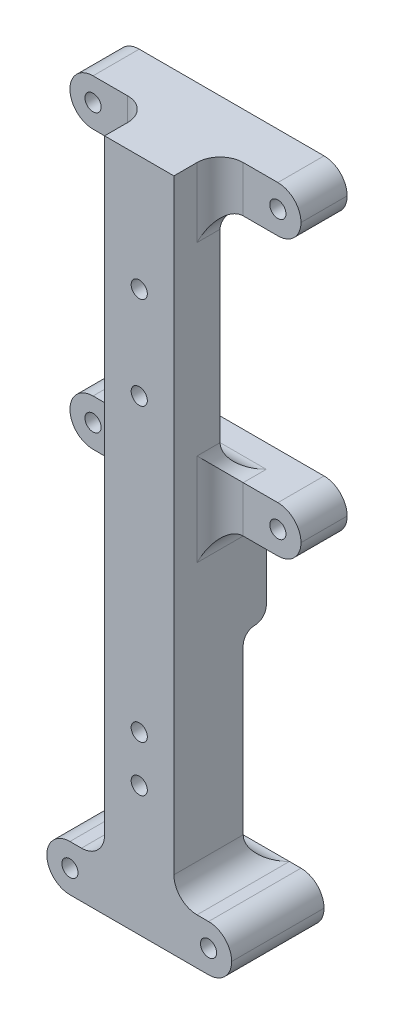
from build123d import *

# Parameters (mm, degrees)
SKETCH1_W                = 50
SKETCH1_H                = 10
BOSS_EXTRUDE1_DEPTH      = 10
BOSS_EXTRUDE1_2_DEPTH    = 10
SKETCH2_W                = 15
SKETCH2_H                = 70
BOSS_EXTRUDE2_DEPTH      = 10
CUT_EXTRUDE1_REACH       = 49.434
SKETCH3_R                = 1.75
CUT_EXTRUDE2_REACH       = 46.159
SKETCH4_R                = 1.75
FILLET2_R                = 5
FILLET4_R                = 5
FILLET5_R                = 5
FILLET6_R                = 5
SKETCH5_W                = 15
SKETCH5_H                = 20
BOSS_EXTRUDE3_DEPTH      = 66
BOSS_EXTRUDE4_DEPTH      = 20
BOSS_EXTRUDE4_DEPTH_BACK = 20
SKETCH6_W                = 20
SKETCH6_H                = 10
CUT_EXTRUDE3_REACH       = 117.525
SKETCH7_R                = 1.75
FILLET7_R                = 5
FILLET9_R                = 5
FILLET10_R               = 5
SKETCH8_R                = 1.75
CUT_EXTRUDE4_DEPTH       = 116.524889093
SKETCH11_W               = 15
SKETCH11_H               = 43
CUT_EXTRUDE5_DEPTH       = 5
FILLET11_R               = 5
FILLET13_R               = 2.5


# Some blends are built 0.0001 mm under size
with BuildPart() as part:
    # Sketch1 → Boss-Extrude1 (new body)
    with BuildSketch(Plane.XY):
        with Locations((0, 30)):
            Rectangle(SKETCH1_W, SKETCH1_H)
    extrude(amount=BOSS_EXTRUDE1_DEPTH)



with BuildPart() as body_2:
    # Sketch1 → Boss-Extrude1 2 (new body)
    with BuildSketch(Plane.XY):
        with Locations((0, -30)):
            Rectangle(SKETCH1_W, SKETCH1_H)
    extrude(amount=BOSS_EXTRUDE1_2_DEPTH)


with BuildPart() as part_1:
    add(part.part)

    add(body_2.part)  # Boss-Extrude2 merges body 2
    # Sketch2 → Boss-Extrude2 (add)
    with BuildSketch(Plane.XY.offset(10)):
        Rectangle(SKETCH2_W, SKETCH2_H)
    extrude(amount=BOSS_EXTRUDE2_DEPTH)

    # Sketch3 → Cut-Extrude1 (cut, up to next)
    with BuildSketch(Plane.XY.offset(20), mode=Mode.PRIVATE) as cut_extrude1_sk1:
        with Locations((0, 10)):
            Circle(SKETCH3_R)
    cut_extrude1_tool1 = extrude(cut_extrude1_sk1.sketch, amount=-CUT_EXTRUDE1_REACH, mode=Mode.PRIVATE) & part_1.part
    # Sketch3 → Cut-Extrude1 (cut, up to next)
    with BuildSketch(Plane.XY.offset(20), mode=Mode.PRIVATE) as cut_extrude1_sk2:
        with Locations((0, -10)):
            Circle(SKETCH3_R)
    cut_extrude1_tool2 = extrude(cut_extrude1_sk2.sketch, amount=-CUT_EXTRUDE1_REACH, mode=Mode.PRIVATE) & part_1.part
    add(cut_extrude1_tool1.solids().sort_by_distance((0, 10, 20))[0], mode=Mode.SUBTRACT)
    add(cut_extrude1_tool2.solids().sort_by_distance((0, -10, 20))[0], mode=Mode.SUBTRACT)

    # Sketch4 → Cut-Extrude2 (cut, up to next)
    with BuildSketch(Plane.XY.offset(10), mode=Mode.PRIVATE) as cut_extrude2_sk1:
        with Locations((-20, 30)):
            Circle(SKETCH4_R)
    cut_extrude2_tool1 = extrude(cut_extrude2_sk1.sketch, amount=-CUT_EXTRUDE2_REACH, mode=Mode.PRIVATE) & part_1.part
    # Sketch4 → Cut-Extrude2 (cut, up to next)
    with BuildSketch(Plane.XY.offset(10), mode=Mode.PRIVATE) as cut_extrude2_sk2:
        with Locations((-20, -30)):
            Circle(SKETCH4_R)
    cut_extrude2_tool2 = extrude(cut_extrude2_sk2.sketch, amount=-CUT_EXTRUDE2_REACH, mode=Mode.PRIVATE) & part_1.part
    # Sketch4 → Cut-Extrude2 (cut, up to next)
    with BuildSketch(Plane.XY.offset(10), mode=Mode.PRIVATE) as cut_extrude2_sk3:
        with Locations((20, 30)):
            Circle(SKETCH4_R)
    cut_extrude2_tool3 = extrude(cut_extrude2_sk3.sketch, amount=-CUT_EXTRUDE2_REACH, mode=Mode.PRIVATE) & part_1.part
    # Sketch4 → Cut-Extrude2 (cut, up to next)
    with BuildSketch(Plane.XY.offset(10), mode=Mode.PRIVATE) as cut_extrude2_sk4:
        with Locations((20, -30)):
            Circle(SKETCH4_R)
    cut_extrude2_tool4 = extrude(cut_extrude2_sk4.sketch, amount=-CUT_EXTRUDE2_REACH, mode=Mode.PRIVATE) & part_1.part
    add(cut_extrude2_tool1.solids().sort_by_distance((-20, 30, 10))[0], mode=Mode.SUBTRACT)
    add(cut_extrude2_tool2.solids().sort_by_distance((-20, -30, 10))[0], mode=Mode.SUBTRACT)
    add(cut_extrude2_tool3.solids().sort_by_distance((20, 30, 10))[0], mode=Mode.SUBTRACT)
    add(cut_extrude2_tool4.solids().sort_by_distance((20, -30, 10))[0], mode=Mode.SUBTRACT)

    # Fillet2
    fillet2_edges = [part_1.edges().sort_by_distance(p)[0] for p in [
        (25, -35, 5),
        (25, -25, 5),
        (25, 35, 5),
        (25, 25, 5),
        (-25, 35, 5),
        (-25, 25, 5),
        (-25, -25, 5),
        (-25, -35, 5),
    ]]
    fillet(fillet2_edges, radius=FILLET2_R - 0.0001)  # a hair under: the kernel refuses the full size

    # Fillet4
    # the kernel refuses this fillet: 5 mm, written as the material it adds along each edge
    with BuildSketch(Plane(origin=(7.5, 25, 10), x_dir=(0, 0, -1), z_dir=(-1, 0, 0))) as fillet4_piece_1:
        with BuildLine():
            CenterArc((FILLET4_R, FILLET4_R), FILLET4_R, 180, 90)
            Line((0, FILLET4_R), (0, 0))
            Line((0, 0), (FILLET4_R, 0))
        make_face()
    extrude(amount=15)
    with BuildSketch(Plane(origin=(-7.5, -25, 10), x_dir=(0, 1, 0), z_dir=(1, 0, 0))) as fillet4_piece_2:
        with BuildLine():
            CenterArc((FILLET4_R, -FILLET4_R), FILLET4_R, 90, 90)
            Line((0, -FILLET4_R), (0, 0))
            Line((0, 0), (FILLET4_R, 0))
        make_face()
    extrude(amount=15)

    # Fillet5
    fillet5_edges = [part_1.edges().sort_by_distance(p)[0] for p in [
        (7.5, -25, 7.5),
        (7.5, 25, 7.5),
    ]]
    fillet(fillet5_edges, radius=FILLET5_R - 0.0001)  # a hair under: the kernel refuses the full size

    # Fillet6
    fillet6_edges = [part_1.edges().sort_by_distance(p)[0] for p in [
        (-7.5, -25, 7.5),
        (-7.5, 25, 7.5),
    ]]
    fillet(fillet6_edges, radius=FILLET6_R - 0.0001)  # a hair under: the kernel refuses the full size

    # Sketch5 → Boss-Extrude3 (add)
    with BuildSketch(Plane.XZ.offset(35)):
        with Locations((0, 10)):
            Rectangle(SKETCH5_W, SKETCH5_H)
    extrude(amount=BOSS_EXTRUDE3_DEPTH)

    # Sketch6 → Boss-Extrude4 (add, two sides: drawn at the far end of the back side and taken through both)
    with BuildSketch(Plane(origin=(0, 0, 0), x_dir=(0, 0, -1), z_dir=(1, 0, 0)).offset(-BOSS_EXTRUDE4_DEPTH_BACK)):
        with Locations((-10, -106)):
            Rectangle(SKETCH6_W, SKETCH6_H)
    extrude(amount=BOSS_EXTRUDE4_DEPTH + BOSS_EXTRUDE4_DEPTH_BACK)

    # Sketch7 → Cut-Extrude3 (cut, up to next)
    with BuildSketch(Plane.XY.offset(20), mode=Mode.PRIVATE) as cut_extrude3_sk1:
        with Locations((-15, -106)):
            Circle(SKETCH7_R)
    cut_extrude3_tool1 = extrude(cut_extrude3_sk1.sketch, amount=-CUT_EXTRUDE3_REACH, mode=Mode.PRIVATE) & part_1.part
    # Sketch7 → Cut-Extrude3 (cut, up to next)
    with BuildSketch(Plane.XY.offset(20), mode=Mode.PRIVATE) as cut_extrude3_sk2:
        with Locations((15, -106)):
            Circle(SKETCH7_R)
    cut_extrude3_tool2 = extrude(cut_extrude3_sk2.sketch, amount=-CUT_EXTRUDE3_REACH, mode=Mode.PRIVATE) & part_1.part
    add(cut_extrude3_tool1.solids().sort_by_distance((-15, -106, 20))[0], mode=Mode.SUBTRACT)
    add(cut_extrude3_tool2.solids().sort_by_distance((15, -106, 20))[0], mode=Mode.SUBTRACT)

    # Fillet7
    fillet7_edges = [part_1.edges().sort_by_distance(p)[0] for p in [
        (20, -111, 10),
        (20, -101, 10),
        (-20, -111, 10),
        (-20, -101, 10),
    ]]
    fillet(fillet7_edges, radius=FILLET7_R - 0.0001)  # a hair under: the kernel refuses the full size

    # Fillet9
    fillet9_edges = [part_1.edges().sort_by_distance(p)[0] for p in [
        (-7.5, -35, 5),
        (7.5, -35, 5),
    ]]
    fillet(fillet9_edges, radius=FILLET9_R)

    # Fillet10
    fillet10_edges = [part_1.edges().sort_by_distance(p)[0] for p in [
        (7.5, -30.00005, 10),
        (7.5, 27.50005, 10),
        (-7.5, -30.00005, 10),
        (-7.5, 27.50005, 10),
    ]]
    fillet(fillet10_edges, radius=FILLET10_R)

    # Sketch8 → Cut-Extrude4 (cut, through all)
    with BuildSketch(Plane.XY.offset(20)):
        with Locations((0, -73)):
            Circle(SKETCH8_R)
        with Locations((0, -83)):
            Circle(SKETCH8_R)
    extrude(amount=-CUT_EXTRUDE4_DEPTH, mode=Mode.SUBTRACT)

    # Sketch11 → Cut-Extrude5 (cut)
    with BuildSketch(Plane(origin=(0, 0, 0), x_dir=(-1, 0, 0), z_dir=(0, 0, -1))):
        with Locations((0, -79.5)):
            Rectangle(SKETCH11_W, SKETCH11_H)
    extrude(amount=-CUT_EXTRUDE5_DEPTH, mode=Mode.SUBTRACT)

    # Fillet11
    fillet11_edges = [part_1.edges().sort_by_distance(p)[0] for p in [
        (-7.5, -101, 12.5),
        (7.5, -101, 12.5),
        (0, -101, 5),
    ]]
    fillet(fillet11_edges, radius=FILLET11_R - 0.0001)  # a hair under: the kernel refuses the full size

    # Fillet13
    fillet13_edges = [part_1.edges().sort_by_distance(p)[0] for p in [
        (0, -58, 5),
    ]]
    fillet(fillet13_edges, radius=FILLET13_R)
    fillet13_2_edges = [part_1.edges().sort_by_distance(p)[0] for p in [
        (0, -58, 0),
    ]]
    fillet(fillet13_2_edges, radius=FILLET13_R - 0.0001)  # a hair under: the kernel refuses the full size


solid = part_1.part
